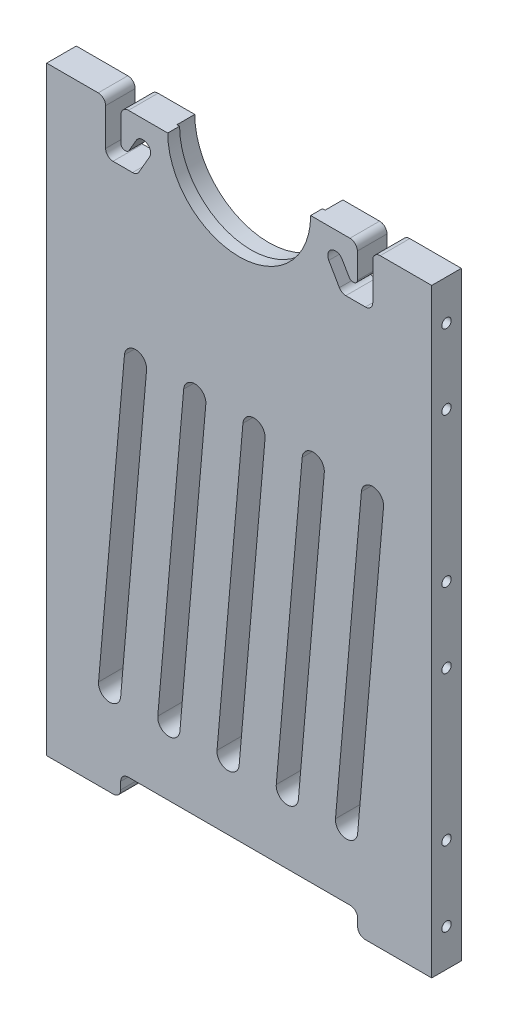
from build123d import *

# Parameters (mm, degrees)
SKETCH1_W                       = 165.1
SKETCH1_H                       = 12.7
BOSS_EXTRUDE1_DEPTH             = 128.5875
SKETCH2_R                       = 30.63494
CUT_EXTRUDE1_DEPTH              = 154.33146336
SKETCH3_R                       = 31.75
CUT_EXTRUDE2_DEPTH              = 7.62
CUT_EXTRUDE3_DEPTH              = 154.33146336
FILLET1_R                       = 3.175
FILLET2_R                       = 1.5875
SKETCH5_W                       = 101.6
SKETCH5_H                       = 9.525
CUT_EXTRUDE4_DEPTH              = 154.33146336
FILLET3_R                       = 3.175
F_21_0_159_DIAMETER_HOLE2_D     = 4.0386
F_21_0_159_DIAMETER_HOLE2_DEPTH = 20.6375
F_21_0_159_DIAMETER_HOLE2_TIP   = 1.213317848
CUT_EXTRUDE5_DEPTH              = 154.33146336
SKETCH11_W                      = 25.4
SKETCH11_H                      = 19.05
CUT_EXTRUDE6_DEPTH              = 6.35
FILLET4_R                       = 3.175


# Read off the part's stored shape, not the designer's step: #21 (0.159) Diameter Hole1
with BuildPart() as part:
    # Sketch1 → Boss-Extrude1 (new, symmetric)
    with BuildSketch(Plane(origin=(0, 0, 0), x_dir=(1, 0, 0), z_dir=(0, 1, 0))):
        Rectangle(SKETCH1_W, SKETCH1_H)
    extrude(amount=BOSS_EXTRUDE1_DEPTH, both=True)

    # Sketch2 → Cut-Extrude1 (cut, through all)
    with BuildSketch(Plane.XY.offset(6.35)):
        with Locations((0, 128.5875)):
            Circle(SKETCH2_R)
    extrude(amount=-CUT_EXTRUDE1_DEPTH, mode=Mode.SUBTRACT)

    # Sketch3 → Cut-Extrude2 (cut)
    with BuildSketch(Plane(origin=(0, 0, -6.35), x_dir=(-1, 0, 0), z_dir=(0, 0, -1))):
        with Locations((0, 128.5875)):
            Circle(SKETCH3_R)
    extrude(amount=-CUT_EXTRUDE2_DEPTH, mode=Mode.SUBTRACT)

    # Sketch4 → Cut-Extrude3 (cut, through all)
    with BuildSketch(Plane.XY.offset(6.35)):
        with BuildLine():
            Line((57.277, 128.5875), (57.277, 106.3625))
            Line((57.277, 106.3625), (43.877983689, 106.3625))
            Line((43.877983689, 106.3625), (38.415384653, 115.823999072))
            ThreePointArc((38.415384653, 115.823999072), (39.623999536, 120.334615615), (44.134615883, 119.126))
            Line((44.134615883, 119.126), (47.690804866, 112.9665))
            Line((47.690804866, 112.9665), (50.673, 112.9665))
            Line((50.673, 112.9665), (50.673, 128.5875))
            Line((50.673, 128.5875), (57.277, 128.5875))
        make_face()
        with BuildLine():
            Line((-50.673, 128.5875), (-57.277, 128.5875))
            Line((-57.277, 128.5875), (-57.277, 106.3625))
            Line((-57.277, 106.3625), (-43.877983689, 106.3625))
            Line((-43.877983689, 106.3625), (-38.415384653, 115.823999072))
            ThreePointArc((-38.415384653, 115.823999072), (-39.623999536, 120.334615615), (-44.134615883, 119.126))
            Line((-44.134615883, 119.126), (-47.690804866, 112.9665))
            Line((-47.690804866, 112.9665), (-50.673, 112.9665))
            Line((-50.673, 112.9665), (-50.673, 128.5875))
        make_face()
    extrude(amount=-CUT_EXTRUDE3_DEPTH, mode=Mode.SUBTRACT)

    # Fillet1
    fillet1_edges = [part.edges().sort_by_distance(p)[0] for p in [
        (50.673, 128.5875, 0),
        (57.277, 128.5875, 0),
        (57.277, 106.3625, 0),
        (43.877983689, 106.3625, 0),
        (-43.877983689, 106.3625, 0),
        (-57.277, 106.3625, 0),
        (-57.277, 128.5875, 0),
        (-50.673, 128.5875, 0),
    ]]
    fillet(fillet1_edges, radius=FILLET1_R)

    # Fillet2
    fillet2_edges = [part.edges().sort_by_distance(p)[0] for p in [
        (47.690804866, 112.9665, 0),
        (50.673, 112.9665, 0),
        (-50.673, 112.9665, 0),
        (-47.690804866, 112.9665, 0),
    ]]
    fillet(fillet2_edges, radius=FILLET2_R)

    # Sketch5 → Cut-Extrude4 (cut, through all)
    with BuildSketch(Plane.XY.offset(6.35)):
        with Locations((0, -123.825)):
            Rectangle(SKETCH5_W, SKETCH5_H)
    extrude(amount=-CUT_EXTRUDE4_DEPTH, mode=Mode.SUBTRACT)

    # Fillet3
    fillet3_edges = [part.edges().sort_by_distance(p)[0] for p in [
        (-50.8, -128.5875, 0),
        (-50.8, -119.0625, 0),
        (50.8, -119.0625, 0),
        (50.8, -128.5875, 0),
    ]]
    fillet(fillet3_edges, radius=FILLET3_R)

    # #21 (0.159) Diameter Hole1 outline → #21 (0.159) Diameter Hole1 (revolve, cut)
    with BuildSketch(Plane(origin=(0, 111.41250006, 0), x_dir=(0, 1, 0), z_dir=(0, 0, -1))):
        Polygon((0, 82.55), (0, 60.699182152), (2.0193, 61.9125), (2.0193, 82.55), align=None)
    revolve(axis=Axis((0, 111.41250006, 0), (1, 0, 0)), mode=Mode.SUBTRACT)

    # 21 _0.159_ Diameter Hole1 2 outline → 21 _0.159_ Diameter Hole1 2 (revolve, cut)
    with BuildSketch(Plane(origin=(0, 79.412500052, 0), x_dir=(0, 1, 0), z_dir=(0, 0, -1))):
        Polygon((0, 82.55), (0, 60.699182152), (2.0193, 61.9125), (2.0193, 82.55), align=None)
    revolve(axis=Axis((0, 79.412500052, 0), (1, 0, 0)), mode=Mode.SUBTRACT)

    # 21 _0.159_ Diameter Hole1 3 outline → 21 _0.159_ Diameter Hole1 3 (revolve, cut)
    with BuildSketch(Plane(origin=(0, 15.412500036, 0), x_dir=(0, 1, 0), z_dir=(0, 0, -1))):
        Polygon((0, 82.55), (0, 60.699182152), (2.0193, 61.9125), (2.0193, 82.55), align=None)
    revolve(axis=Axis((0, 15.412500036, 0), (1, 0, 0)), mode=Mode.SUBTRACT)

    # 21 _0.159_ Diameter Hole1 4 outline → 21 _0.159_ Diameter Hole1 4 (revolve, cut)
    with BuildSketch(Plane(origin=(0, -16.587499972, 0), x_dir=(0, 1, 0), z_dir=(0, 0, -1))):
        Polygon((0, 82.55), (0, 60.699182152), (2.0193, 61.9125), (2.0193, 82.55), align=None)
    revolve(axis=Axis((0, -16.587499972, 0), (1, 0, 0)), mode=Mode.SUBTRACT)

    # 21 _0.159_ Diameter Hole1 5 outline → 21 _0.159_ Diameter Hole1 5 (revolve, cut)
    with BuildSketch(Plane(origin=(0, -80.587499988, 0), x_dir=(0, 1, 0), z_dir=(0, 0, -1))):
        Polygon((0, 82.55), (0, 60.699182152), (2.0193, 61.9125), (2.0193, 82.55), align=None)
    revolve(axis=Axis((0, -80.587499988, 0), (1, 0, 0)), mode=Mode.SUBTRACT)

    # 21 _0.159_ Diameter Hole1 6 outline → 21 _0.159_ Diameter Hole1 6 (revolve, cut)
    with BuildSketch(Plane(origin=(0, -112.587499996, 0), x_dir=(0, 1, 0), z_dir=(0, 0, -1))):
        Polygon((0, 82.55), (0, 60.699182152), (2.0193, 61.9125), (2.0193, 82.55), align=None)
    revolve(axis=Axis((0, -112.587499996, 0), (1, 0, 0)), mode=Mode.SUBTRACT)

    # #21 (0.159) Diameter Hole2
    with Locations(Plane.ZY.offset(82.55)):
        with Locations((0, -112.587499996), (0, -80.587499988), (0, -16.587499972), (2.943873534, 16.784159444), (0, 79.412500052), (0, 111.41250006)):
            Hole(F_21_0_159_DIAMETER_HOLE2_D / 2, depth=F_21_0_159_DIAMETER_HOLE2_DEPTH)
            with Locations((0, 0, -(F_21_0_159_DIAMETER_HOLE2_DEPTH + F_21_0_159_DIAMETER_HOLE2_TIP / 2))):  # 118° drill point
                Cone(0, F_21_0_159_DIAMETER_HOLE2_D / 2, F_21_0_159_DIAMETER_HOLE2_TIP, mode=Mode.SUBTRACT)

    # Sketch10 → Cut-Extrude5 (cut, through all)
    with BuildSketch(Plane.XY.offset(6.35)):
        with BuildLine():
            Line((-60.30687725, -90.072420775), (-49.195816982, 36.927579225))
            ThreePointArc((-49.195816982, 36.927579225), (-44.036360507, 41.25687725), (-39.707062483, 36.097420775))
            Line((-39.707062483, 36.097420775), (-50.81812275, -90.902579225))
            ThreePointArc((-50.81812275, -90.902579225), (-55.977579225, -95.23187725), (-60.30687725, -90.072420775))
        make_face()
        with BuildLine():
            Line((-25.41812275, -90.902579225), (-14.307062483, 36.097420775))
            ThreePointArc((-14.307062483, 36.097420775), (-18.636360507, 41.25687725), (-23.795816982, 36.927579225))
            Line((-23.795816982, 36.927579225), (-34.90687725, -90.072420775))
            ThreePointArc((-34.90687725, -90.072420775), (-30.577579225, -95.23187725), (-25.41812275, -90.902579225))
        make_face()
        with BuildLine():
            Line((-0.01812275, -90.902579225), (11.092937517, 36.097420775))
            ThreePointArc((11.092937517, 36.097420775), (6.763639493, 41.25687725), (1.604183018, 36.927579225))
            Line((1.604183018, 36.927579225), (-9.50687725, -90.072420775))
            ThreePointArc((-9.50687725, -90.072420775), (-5.177579225, -95.23187725), (-0.01812275, -90.902579225))
        make_face()
        with BuildLine():
            Line((25.38187725, -90.902579225), (36.492937517, 36.097420775))
            ThreePointArc((36.492937517, 36.097420775), (32.163639493, 41.25687725), (27.004183018, 36.927579225))
            Line((27.004183018, 36.927579225), (15.89312275, -90.072420775))
            ThreePointArc((15.89312275, -90.072420775), (20.222420775, -95.23187725), (25.38187725, -90.902579225))
        make_face()
        with BuildLine():
            Line((50.78187725, -90.902579225), (61.892937517, 36.097420775))
            ThreePointArc((61.892937517, 36.097420775), (57.563639493, 41.25687725), (52.404183018, 36.927579225))
            Line((52.404183018, 36.927579225), (41.29312275, -90.072420775))
            ThreePointArc((41.29312275, -90.072420775), (45.622420775, -95.23187725), (50.78187725, -90.902579225))
        make_face()
    extrude(amount=-CUT_EXTRUDE5_DEPTH, mode=Mode.SUBTRACT)

    # Sketch11 → Cut-Extrude6 (cut)
    with BuildSketch(Plane(origin=(0, 0, -6.35), x_dir=(-1, 0, 0), z_dir=(0, 0, -1))):
        with Locations((0, -109.5375)):
            Rectangle(SKETCH11_W, SKETCH11_H)
    extrude(amount=-CUT_EXTRUDE6_DEPTH, mode=Mode.SUBTRACT)

    # Fillet4
    fillet4_edges = [part.edges().sort_by_distance(p)[0] for p in [
        (12.7, -119.0625, -3.175),
        (12.7, -100.0125, -3.175),
        (-12.7, -100.0125, -3.175),
        (-12.7, -119.0625, -3.175),
    ]]
    fillet(fillet4_edges, radius=FILLET4_R)


solid = part.part
